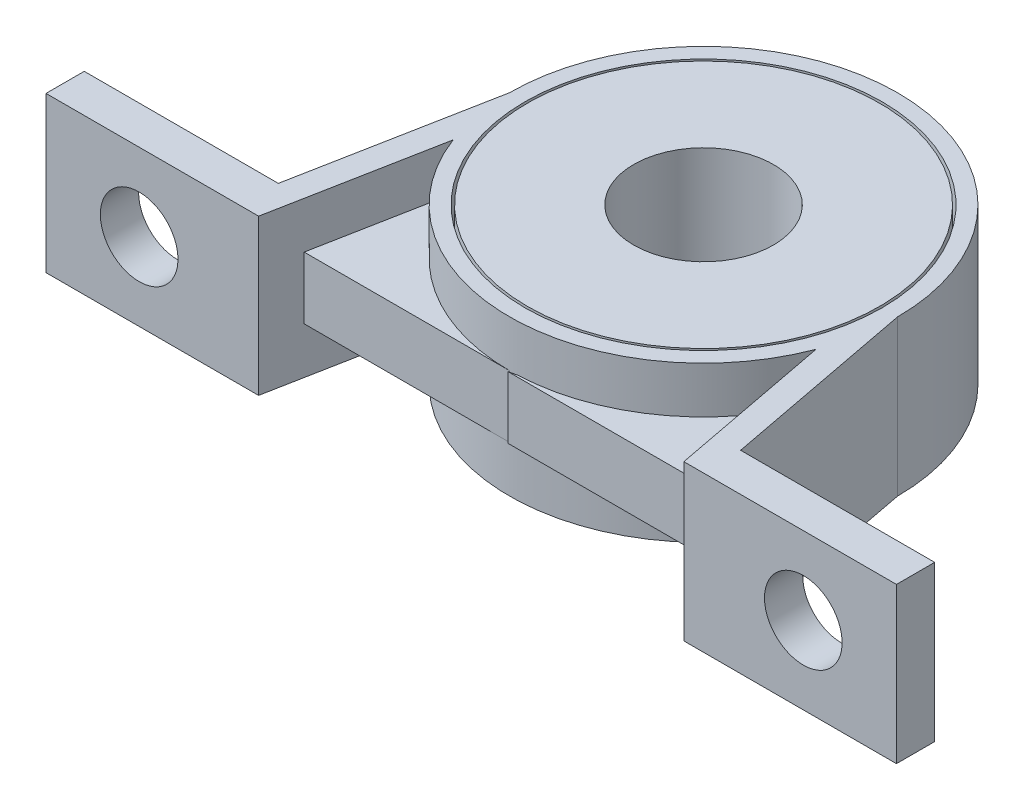
from build123d import *

# Parameters (mm, degrees)
BOSS_EXTRUDE1_DEPTH      = 5
BOSS_EXTRUDE1_DEPTH_BACK = 5
SKETCH1_R                = 11.5
BOSS_EXTRUDE2_START      = -2
BOSS_EXTRUDE2_DEPTH      = 4
BOSS_EXTRUDE3_DEPTH      = 2
BOSS_EXTRUDE3_DEPTH_BACK = 2
BOSS_EXTRUDE4_DEPTH      = 5
BOSS_EXTRUDE4_DEPTH_BACK = 5
SKETCH5_R                = 11.341581645
SKETCH5_R_2              = 10.881998828
BOSS_EXTRUDE5_DEPTH      = 5
BOSS_EXTRUDE5_DEPTH_BACK = 5
SKETCH6_R                = 10.881998828
SKETCH6_R_2              = 5
BOSS_EXTRUDE6_DEPTH      = 5
BOSS_EXTRUDE6_DEPTH_BACK = 8
SKETCH7_R                = 5
SKETCH7_R_2              = 4.5
CUT_EXTRUDE1_DEPTH       = 38.935559418
CUT_EXTRUDE1_DEPTH_BACK  = 38.935559418
SKETCH8_R                = 2.5


# Read off the part's stored shape, not the designer's step: Boss-Extrude2
with BuildPart() as part:
    # Sketch1 → Boss-Extrude1 (new, two sides: drawn at the far end of the back side and taken through both)
    with BuildSketch(Plane(origin=(0, 0, 0), x_dir=(1, 0, 0), z_dir=(0, 1, 0)).offset(-BOSS_EXTRUDE1_DEPTH_BACK)):
        with BuildLine():
            Line((-12.5, 0), (-14.888075294, -12.5))
            Line((-14.888075294, -12.5), (-27.388075294, -12.5))
            Line((-27.388075294, -12.5), (-27.388075294, -14.962515671))
            Line((-27.388075294, -14.962515671), (-14.888075294, -14.962515671))
            Line((-14.888075294, -14.962515671), (-13.694037647, -14.962515671))
            Line((-13.694037647, -14.962515671), (-11.684129612, -4.441971995))
            ThreePointArc((-11.684129612, -4.441971995), (0, -12.5), (11.684129612, -4.441971995))
            Line((11.684129612, -4.441971995), (13.694037647, -14.962515671))
            Line((13.694037647, -14.962515671), (14.888075294, -14.962515671))
            Line((14.888075294, -14.962515671), (27.388075294, -14.962515671))
            Line((27.388075294, -14.962515671), (27.388075294, -12.5))
            Line((27.388075294, -12.5), (14.888075294, -12.5))
            Line((14.888075294, -12.5), (12.5, 0))
            ThreePointArc((12.5, 0), (0, 12.5), (-12.5, 0))
        make_face()
        with Locations(Location((0, 0, 0), (0, 0, 270))):
            Circle(SKETCH1_R, mode=Mode.SUBTRACT)
    extrude(amount=BOSS_EXTRUDE1_DEPTH + BOSS_EXTRUDE1_DEPTH_BACK)

    # Boss-Extrude2 outline → Boss-Extrude2 (add)
    with BuildSketch(Plane(origin=(0, 0, 0), x_dir=(1, 0, 0), z_dir=(0, 1, 0)).offset(BOSS_EXTRUDE2_START)):
        with BuildLine():
            ThreePointArc((11.545060202, -4.7918248), (7.158411272, -10.247299549), (0.526660373, -12.488900226))
            add(Edge.make_bspline(
                [(0.526660373, -12.488900226), (0.266171619, -12.548222015), (0, -12.604103366)],
                knots=[0.689319893, 0.689319893, 0.689319893, 0.709533534, 0.709533534, 0.709533534], degree=2))
            Line((0, -12.604103366), (13.243472354, -12.604103366))
            Line((13.243472354, -12.604103366), (11.684129612, -4.441971995))
            add(Edge.make_bspline(
                [(11.684129612, -4.441971995), (11.61743634, -4.618618616), (11.545060202, -4.7918248)],
                knots=[0, 0, 0, 0.020213641, 0.020213641, 0.020213641], degree=2))
        make_face()
    extrude(amount=BOSS_EXTRUDE2_DEPTH)

    # Sketch4 → Boss-Extrude3 (add, two sides: drawn at the far end of the back side and taken through both)
    with BuildSketch(Plane(origin=(0, 0, 0), x_dir=(1, 0, 0), z_dir=(0, 1, 0)).offset(-BOSS_EXTRUDE3_DEPTH_BACK)):
        with BuildLine():
            Line((0, -12.5), (-13.22358382, -12.5))
            Line((-13.22358382, -12.5), (-11.684129612, -4.441971995))
            add(Edge.make_bspline(
                [(0, -12.5), (-9.420476938, -10.800220507), (-11.684129612, -4.441971995)],
                knots=[0, 0, 0, 0.791193812, 0.791193812, 0.791193812], degree=2))
        make_face()
    extrude(amount=BOSS_EXTRUDE3_DEPTH + BOSS_EXTRUDE3_DEPTH_BACK)

    # Sketch8 → Cut-Extrude1 (cut, two sides: drawn at the far end of the back side and taken through both)
    with BuildSketch(Plane(origin=(0, 0, 12.5), x_dir=(-1, 0, 0), z_dir=(0, 0, -1)).offset(-CUT_EXTRUDE1_DEPTH_BACK)):
        with Locations((21.388075294, 0)):
            Circle(SKETCH8_R)
        with Locations((-21.388075294, 0)):
            Circle(SKETCH8_R)
    extrude(amount=CUT_EXTRUDE1_DEPTH + CUT_EXTRUDE1_DEPTH_BACK, mode=Mode.SUBTRACT)


with BuildPart() as body_2:
    # Sketch5 → Boss-Extrude4 (new, two sides: drawn at the far end of the back side and taken through both)
    with BuildSketch(Plane(origin=(0, 0, 0), x_dir=(1, 0, 0), z_dir=(0, 1, 0)).offset(-BOSS_EXTRUDE4_DEPTH_BACK)):
        with Locations(Location((0, 0, 0), (0, 0, 270))):
            Circle(SKETCH5_R)
        with Locations(Location((0, 0, 0), (0, 0, 270))):
            Circle(SKETCH5_R_2, mode=Mode.SUBTRACT)
    extrude(amount=BOSS_EXTRUDE4_DEPTH + BOSS_EXTRUDE4_DEPTH_BACK)



with BuildPart() as body_3:
    # Sketch6 → Boss-Extrude5 (new, two sides: drawn at the far end of the back side and taken through both)
    with BuildSketch(Plane(origin=(0, 0, 0), x_dir=(1, 0, 0), z_dir=(0, 1, 0)).offset(-BOSS_EXTRUDE5_DEPTH_BACK)):
        with Locations(Location((0, 0, 0), (0, 0, 270))):
            Circle(SKETCH6_R)
        with Locations(Location((0, 0, 0), (0, 0, 270))):
            Circle(SKETCH6_R_2, mode=Mode.SUBTRACT)
    extrude(amount=BOSS_EXTRUDE5_DEPTH + BOSS_EXTRUDE5_DEPTH_BACK)


with BuildPart() as body_2_1:
    add(body_2.part)

    add(body_3.part)  # Boss-Extrude6 merges body 3
    # Sketch7 → Boss-Extrude6 (add, two sides: drawn at the far end of the back side and taken through both)
    with BuildSketch(Plane(origin=(0, 0, 0), x_dir=(1, 0, 0), z_dir=(0, 1, 0)).offset(-BOSS_EXTRUDE6_DEPTH_BACK)):
        with Locations(Location((0, 0, 0), (0, 0, 270))):
            Circle(SKETCH7_R)
        with Locations(Location((0, 0, 0), (0, 0, 270))):
            Circle(SKETCH7_R_2, mode=Mode.SUBTRACT)
    extrude(amount=BOSS_EXTRUDE6_DEPTH + BOSS_EXTRUDE6_DEPTH_BACK)


solid = Compound([part.part, body_2_1.part])
